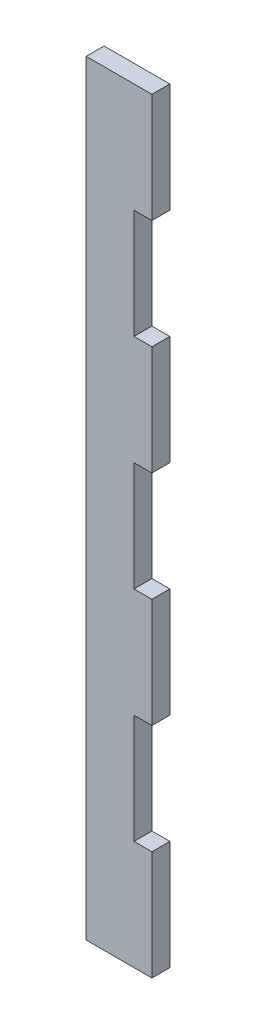
from build123d import *

# Parameters (mm, degrees)
BOSS_EXTRUDE1_DEPTH = 4.7625


with BuildPart() as part:
    # Sketch1 → Boss-Extrude1 (new body)
    with BuildSketch(Plane.XY):
        Polygon((-6.35, 101.6), (-6.35, -101.6), (11.1125, -101.6), (11.1125, -72.571428571), (6.35, -72.571428571), (6.35, -43.542857143), (11.1125, -43.542857143), (11.1125, -14.514285714), (6.35, -14.514285714), (6.35, 14.514285714), (11.1125, 14.514285714), (11.1125, 43.542857143), (6.35, 43.542857143), (6.35, 72.571428571), (11.1125, 72.571428571), (11.1125, 101.6), align=None)
    extrude(amount=BOSS_EXTRUDE1_DEPTH)


solid = part.part
